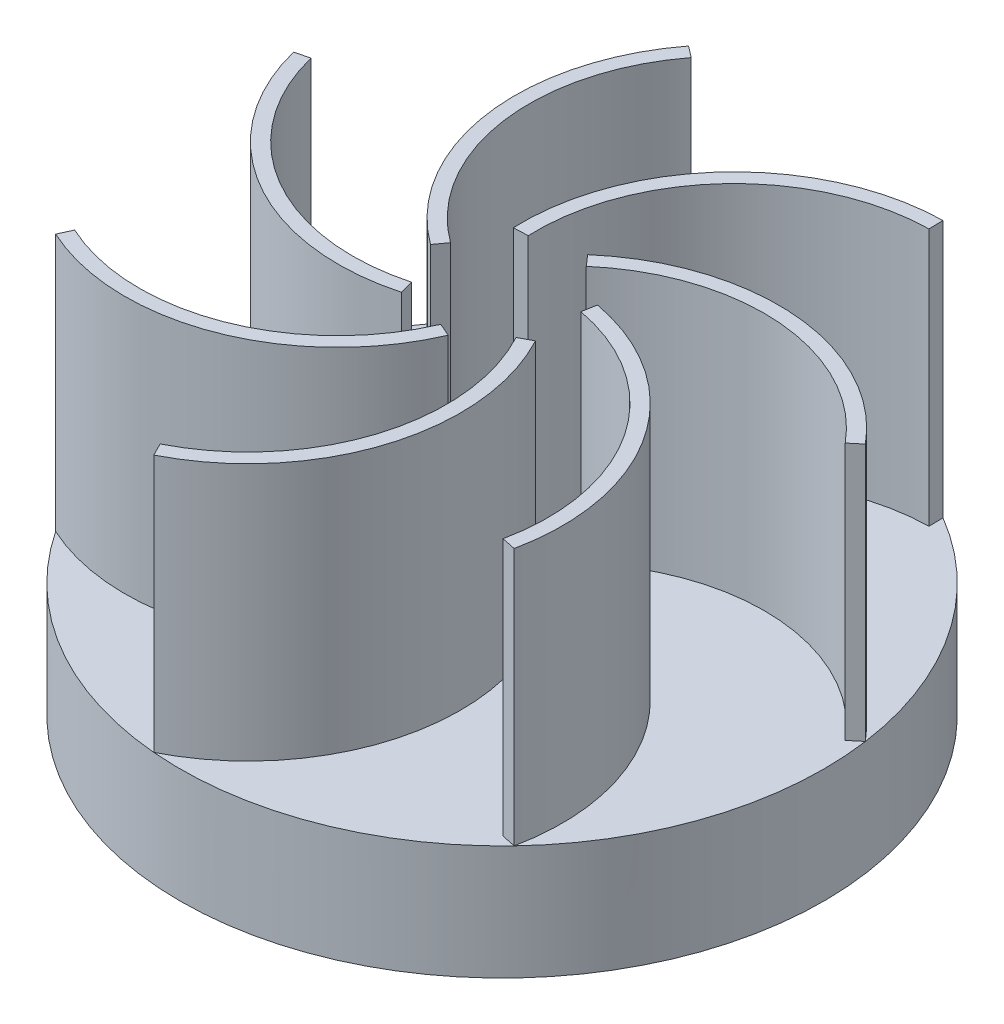
from build123d import *
from build123d.topology import SkipClean

# Parameters (mm, degrees)
SKETCH1_R           = 22.5
BOSS_EXTRUDE1_DEPTH = 2
SKETCH3_R           = 5
CUT_EXTRUDE3_DEPTH  = 10
SKETCH4_R           = 22.5
SKETCH4_R_2         = 5
BOSS_EXTRUDE2_DEPTH = 6
EXTRUDE_THIN1_DEPTH = 18
SKETCH7_R           = 5
SKETCH7_R_2         = 2.5
BOSS_EXTRUDE3_DEPTH = 8


with BuildPart() as part:
    # Sketch1 → Boss-Extrude1 (new body)
    with BuildSketch(Plane(origin=(0, 0, 0), x_dir=(1, 0, 0), z_dir=(0, 1, 0))):
        with Locations(Location((0, 0, 0), (0, 0, 270))):
            Circle(SKETCH1_R)
    extrude(amount=BOSS_EXTRUDE1_DEPTH)

    # Sketch3 → Cut-Extrude3 (cut)
    with BuildSketch(Plane(origin=(0, 2, 0), x_dir=(1, 0, 0), z_dir=(0, 1, 0))):
        with Locations(Location((0, 0, 0), (0, 0, 270))):
            Circle(SKETCH3_R)
    extrude(amount=-CUT_EXTRUDE3_DEPTH, mode=Mode.SUBTRACT)

    # Sketch4 → Boss-Extrude2 (add)
    with SkipClean():  # the faces are left unmerged after this step: merging them gives an invalid solid
        with BuildSketch(Plane(origin=(0, 2, 0), x_dir=(1, 0, 0), z_dir=(0, 1, 0))):
            Circle(SKETCH4_R)
            Circle(SKETCH4_R_2, mode=Mode.SUBTRACT)
        extrude(amount=BOSS_EXTRUDE2_DEPTH)
    add(part.part.scale(1), mode=Mode.REPLACE)  # the faces are merged on a copy

    # Sketch5 → Extrude-Thin1 (add)
    with BuildSketch(Plane(origin=(0, 8, 0), x_dir=(1, 0, 0), z_dir=(0, 1, 0))):
        with BuildLine():
            ThreePointArc((-5, 0), (-10.922252547, 9.886264878), (-7.993390355, 21.032254055))
            Line((-7.993390355, 21.032254055), (-7.200526001, 20.422855896))
            ThreePointArc((-7.200526001, 20.422855896), (-9.932229266, 10.027168755), (-4.408638342, 0.806406467))
            Line((-4.408638342, 0.806406467), (-5, 0))
        make_face()
        with BuildLine():
            ThreePointArc((-3.117449009, 3.909157412), (0.919480049, 14.703346231), (11.459880999, 19.362880145))
            Line((11.459880999, 19.362880145), (11.477777172, 18.363040294))
            ThreePointArc((11.477777172, 18.363040294), (1.646912556, 14.017166992), (-2.118267083, 3.949598459))
            Line((-2.118267083, 3.949598459), (-3.117449009, 3.909157412))
        make_face()
        with BuildLine():
            ThreePointArc((1.11260467, 4.874639561), (12.068825415, 8.448507978), (22.283628222, 3.112862555))
            Line((22.283628222, 3.112862555), (21.513080031, 2.475480812))
            ThreePointArc((21.513080031, 2.475480812), (11.985895632, 7.451952585), (1.767202495, 4.118662254))
            Line((1.767202495, 4.118662254), (1.11260467, 4.874639561))
        make_face()
        with BuildLine():
            ThreePointArc((4.50484434, 2.169418696), (14.130099084, -4.1682291), (16.32734889, -15.48120403))
            Line((16.32734889, -15.48120403), (15.348594839, -15.276166212))
            ThreePointArc((15.348594839, -15.276166212), (13.29925483, -4.72473411), (4.321932549, 1.186289367))
            Line((4.321932549, 1.186289367), (4.50484434, 2.169418696))
        make_face()
        with BuildLine():
            ThreePointArc((4.50484434, -2.169418696), (5.551119941, -13.64620465), (-1.923757172, -22.417608221))
            Line((-1.923757172, -22.417608221), (-2.373695321, -21.524548501))
            ThreePointArc((-2.373695321, -21.524548501), (4.598003885, -13.343599653), (3.622159243, -2.63938361))
            Line((3.622159243, -2.63938361), (4.50484434, -2.169418696))
        make_face()
        with BuildLine():
            ThreePointArc((1.11260467, -4.874639561), (-7.207965739, -12.848309766), (-18.726234847, -12.473096186))
            Line((-18.726234847, -12.473096186), (-18.308544489, -11.564506749))
            ThreePointArc((-18.308544489, -11.564506749), (-7.565637767, -11.914462498), (0.194826148, -4.477546895))
            Line((0.194826148, -4.477546895), (1.11260467, -4.874639561))
        make_face()
        with BuildLine():
            ThreePointArc((-3.117449009, -3.909157412), (-14.539306202, -2.375375571), (-21.427475736, 6.863911682))
            Line((-21.427475736, 6.863911682), (-20.456686231, 7.103844459))
            ThreePointArc((-20.456686231, 7.103844459), (-14.03219987, -1.513492071), (-3.37921501, -2.944026043))
            Line((-3.37921501, -2.944026043), (-3.117449009, -3.909157412))
        make_face()
    extrude(amount=EXTRUDE_THIN1_DEPTH)

    # Sketch7 → Boss-Extrude3 (add, through all)
    with BuildSketch(Plane(origin=(0, 8, 0), x_dir=(1, 0, 0), z_dir=(0, 1, 0))):
        Circle(SKETCH7_R)
        with Locations(Location((0, 0, 0), (0, 0, 270))):
            Circle(SKETCH7_R_2, mode=Mode.SUBTRACT)
    extrude(amount=-BOSS_EXTRUDE3_DEPTH)


solid = part.part
